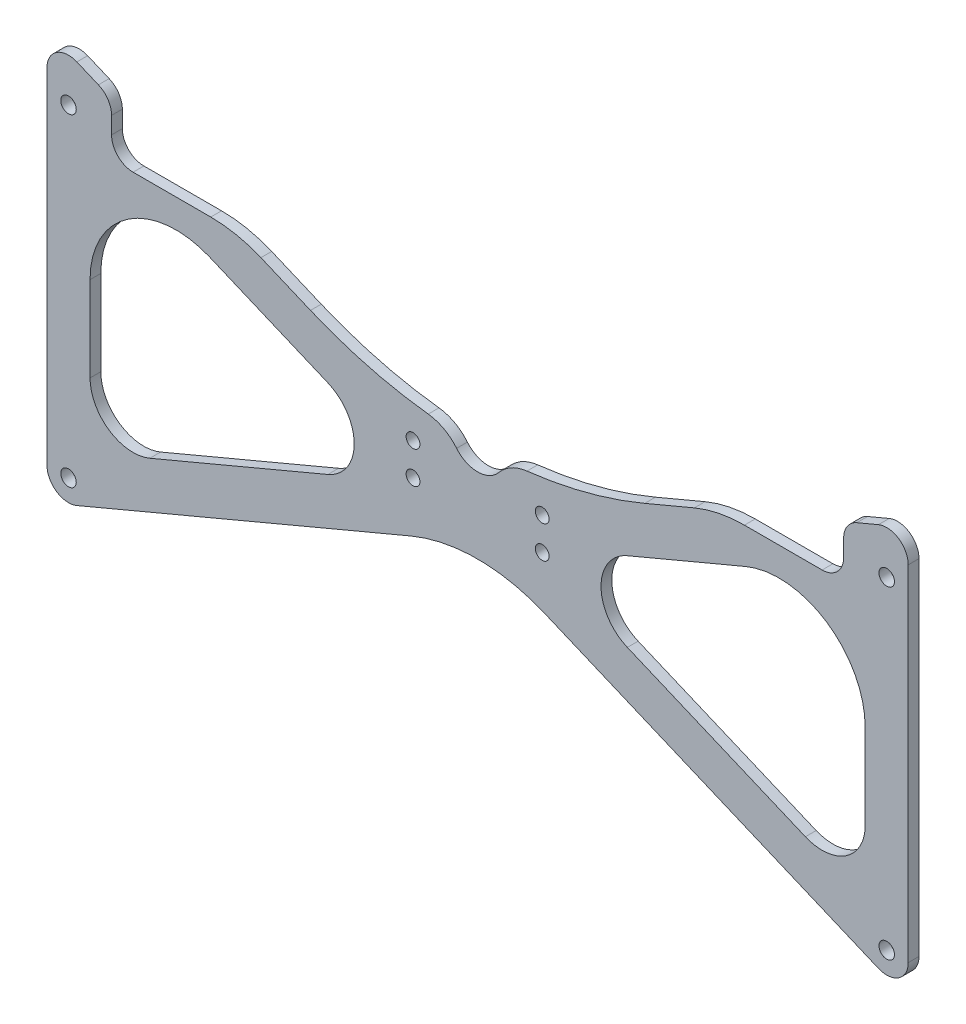
from build123d import *

# Parameters (mm, degrees)
BOSS_EXTRUDE1_DEPTH = 3.175
SKETCH2_R           = 2.286
CUT_EXTRUDE1_DEPTH  = 140.30255965
FILLET1_R           = 12.7
FILLET5_R           = 127
FILLET8_R           = 25.4
FILLET10_R          = 50.8
SKETCH5_R           = 2.032
CUT_EXTRUDE3_DEPTH  = 140.30255965
CUT_EXTRUDE4_DEPTH  = 140.30255965
FILLET6_R           = 6.35
FILLET9_R           = 38.1
CUT_EXTRUDE5_DEPTH  = 140.30255965
FILLET11_R          = 12.7


with BuildPart() as part:
    # Sketch1 → Boss-Extrude1 (new body)
    with BuildSketch(Plane.XY):
        with BuildLine():
            Line((-118.18583805, 56.652384632), (0, 6.889926506))
            Line((0, 6.889926506), (118.18583805, 56.652384632))
            ThreePointArc((118.18583805, 56.652384632), (124.162482855, 56.090081681), (127, 50.8))
            Line((127, 50.8), (127, -50.8))
            ThreePointArc((127, -50.8), (124.162482855, -56.090081681), (118.18583805, -56.652384632))
            Line((118.18583805, -56.652384632), (0, -6.889926506))
            Line((0, -6.889926506), (-118.18583805, -56.652384632))
            ThreePointArc((-118.18583805, -56.652384632), (-124.162482855, -56.090081681), (-127, -50.8))
            Line((-127, -50.8), (-127, 50.8))
            ThreePointArc((-127, 50.8), (-124.162482855, 56.090081681), (-118.18583805, 56.652384632))
        make_face()
        Polygon((-114.3, -41.236389284), (-16.363575452, 0), (-114.3, 41.236389284), align=None, mode=Mode.SUBTRACT)
        Polygon((16.363575452, 0), (114.3, 41.236389284), (114.3, -41.236389284), align=None, mode=Mode.SUBTRACT)
    extrude(amount=BOSS_EXTRUDE1_DEPTH)

    # Sketch2 → Cut-Extrude1 (cut, through all)
    with BuildSketch(Plane.XY.offset(3.175)):
        with Locations((-120.65, 44.45)):
            Circle(SKETCH2_R)
        with Locations((-120.65, -50.8)):
            Circle(SKETCH2_R)
        with Locations((120.65, -50.8)):
            Circle(SKETCH2_R)
        with Locations((120.65, 44.45)):
            Circle(SKETCH2_R)
    extrude(amount=-CUT_EXTRUDE1_DEPTH, mode=Mode.SUBTRACT)

    # Fillet1
    fillet1_edges = [part.edges().sort_by_distance(p)[0] for p in [
        (114.3, -41.236389284, 1.5875),
        (16.363575452, 0, 1.5875),
        (-114.3, -41.236389284, 1.5875),
        (-16.363575452, 0, 1.5875),
    ]]
    fillet(fillet1_edges, radius=FILLET1_R)

    # Fillet5
    fillet5_edges = [part.edges().sort_by_distance(p)[0] for p in [
        (0, 6.889926506, 1.5875),
    ]]
    fillet(fillet5_edges, radius=FILLET5_R)

    # Fillet8
    fillet8_edges = [part.edges().sort_by_distance(p)[0] for p in [
        (114.3, 41.236389284, 1.5875),
        (-114.3, 41.236389284, 1.5875),
    ]]
    fillet(fillet8_edges, radius=FILLET8_R)

    # Fillet10
    fillet10_edges = [part.edges().sort_by_distance(p)[0] for p in [
        (0, -6.889926506, 1.5875),
    ]]
    fillet(fillet10_edges, radius=FILLET10_R)

    # Sketch5 → Cut-Extrude3 (cut, through all)
    with BuildSketch(Plane.XY.offset(3.175)):
        with Locations((-19.05, 9.525)):
            Circle(SKETCH5_R)
        with Locations((-19.05, 0)):
            Circle(SKETCH5_R)
    cut_extrude3 = extrude(amount=-CUT_EXTRUDE3_DEPTH, mode=Mode.SUBTRACT)

    # Mirror1: Cut-Extrude3 across plane
    add(cut_extrude3.mirror(Plane(origin=(0, 0, 0), x_dir=(0, 0, 1), z_dir=(1, 0, 0))), mode=Mode.SUBTRACT)

    # Sketch6 → Cut-Extrude4 (cut, through all)
    with BuildSketch(Plane.XY.offset(3.175)):
        Polygon((-107.95, 52.342558085), (-107.95, 36.785058085), (-71.0009375, 36.785058085), align=None)
    cut_extrude4 = extrude(amount=-CUT_EXTRUDE4_DEPTH, mode=Mode.SUBTRACT)

    # Mirror2: Cut-Extrude4 across plane
    add(cut_extrude4.mirror(Plane(origin=(0, 0, 0), x_dir=(0, 0, 1), z_dir=(1, 0, 0))), mode=Mode.SUBTRACT)

    # Fillet6
    fillet6_edges = [part.edges().sort_by_distance(p)[0] for p in [
        (-107.95, 52.342558085, 1.5875),
        (-107.95, 36.785058085, 1.5875),
        (107.95, 52.342558085, 1.5875),
        (107.95, 36.785058085, 1.5875),
    ]]
    fillet(fillet6_edges, radius=FILLET6_R)

    # Fillet9
    fillet9_edges = [part.edges().sort_by_distance(p)[0] for p in [
        (71.0009375, 36.785058085, 1.5875),
        (-71.0009375, 36.785058085, 1.5875),
    ]]
    fillet(fillet9_edges, radius=FILLET9_R)

    # Sketch7 → Cut-Extrude5 (cut, through all)
    with BuildSketch(Plane.XY.offset(3.175)):
        with BuildLine():
            ThreePointArc((-7.9375, 17.936746208), (0, 11.034811901), (7.9375, 17.936746208))
            ThreePointArc((7.9375, 17.936746208), (0, 17.688456625), (-7.9375, 17.936746208))
        make_face()
    extrude(amount=-CUT_EXTRUDE5_DEPTH, mode=Mode.SUBTRACT)

    # Fillet11
    fillet11_edges = [part.edges().sort_by_distance(p)[0] for p in [
        (7.9375, 17.936746208, 1.5875),
        (-7.9375, 17.936746208, 1.5875),
    ]]
    fillet(fillet11_edges, radius=FILLET11_R)


solid = part.part
